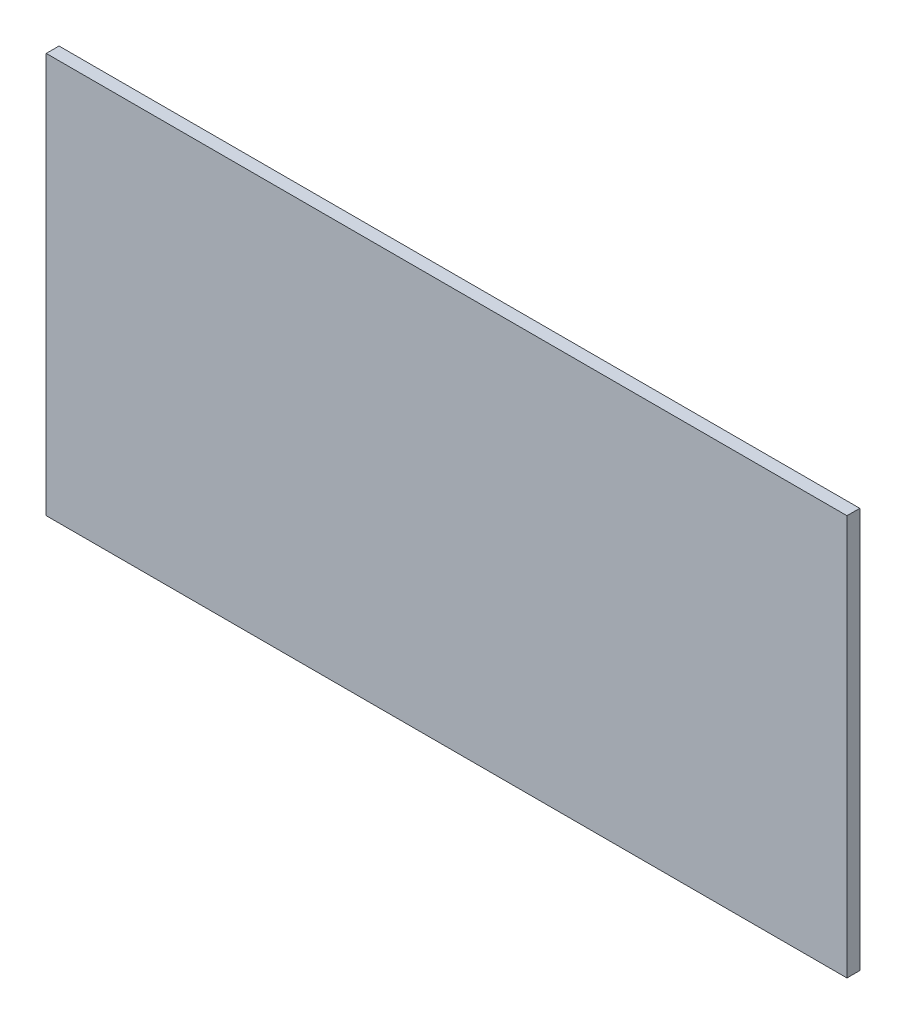
from build123d import *

# Parameters (mm, degrees)
SKIZZE1_W                       = 250
SKIZZE1_H                       = 125
AUFSATZ_LINEAR_AUSTRAGEN1_DEPTH = 4


with BuildPart() as part:
    # Skizze1 → Aufsatz-Linear austragen1 (new body)
    with BuildSketch(Plane.XY):
        with Locations((125, 62.5)):
            Rectangle(SKIZZE1_W, SKIZZE1_H)
    extrude(amount=AUFSATZ_LINEAR_AUSTRAGEN1_DEPTH)


solid = part.part
